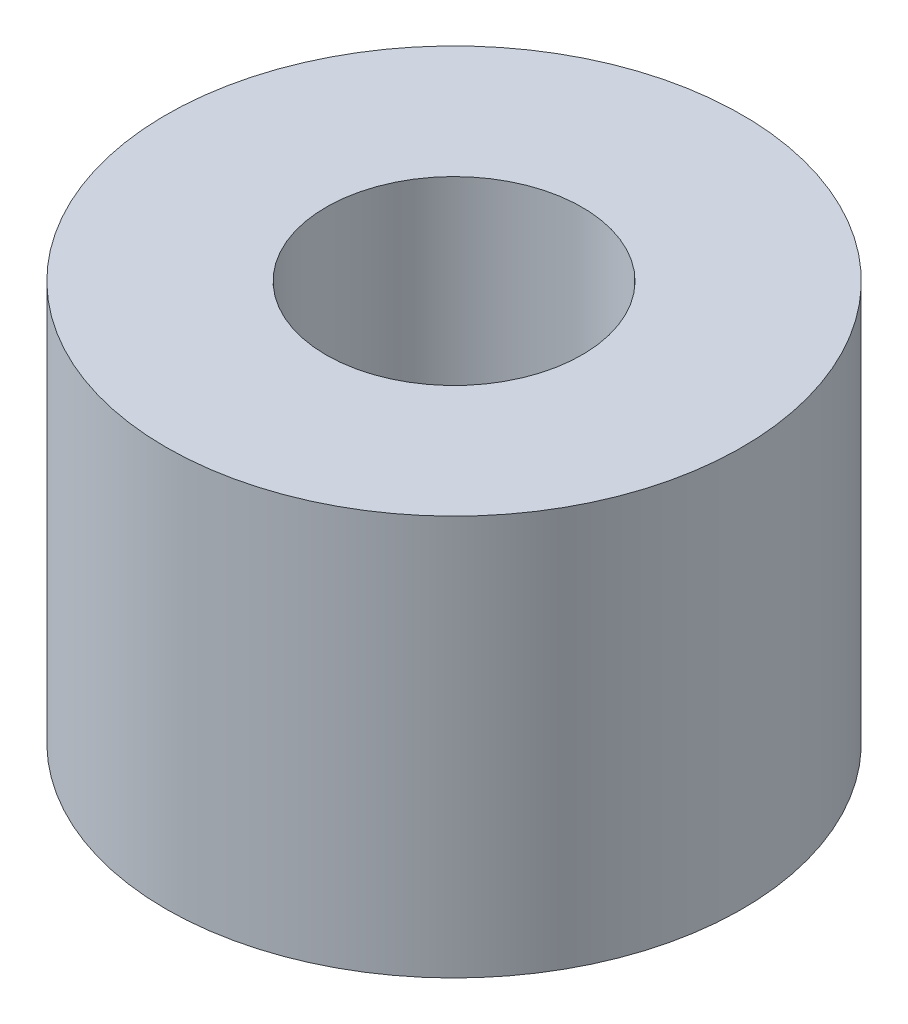
from build123d import *

# Parameters (mm, degrees)
SKETCH1_R           = 3.6
SKETCH1_R_2         = 1.6
BOSS_EXTRUDE1_DEPTH = 5


with BuildPart() as part:
    # Sketch1 → Boss-Extrude1 (new body)
    with BuildSketch(Plane(origin=(0, 0, 0), x_dir=(1, 0, 0), z_dir=(0, 1, 0))):
        Circle(SKETCH1_R)
        Circle(SKETCH1_R_2, mode=Mode.SUBTRACT)
    extrude(amount=BOSS_EXTRUDE1_DEPTH)


solid = part.part
